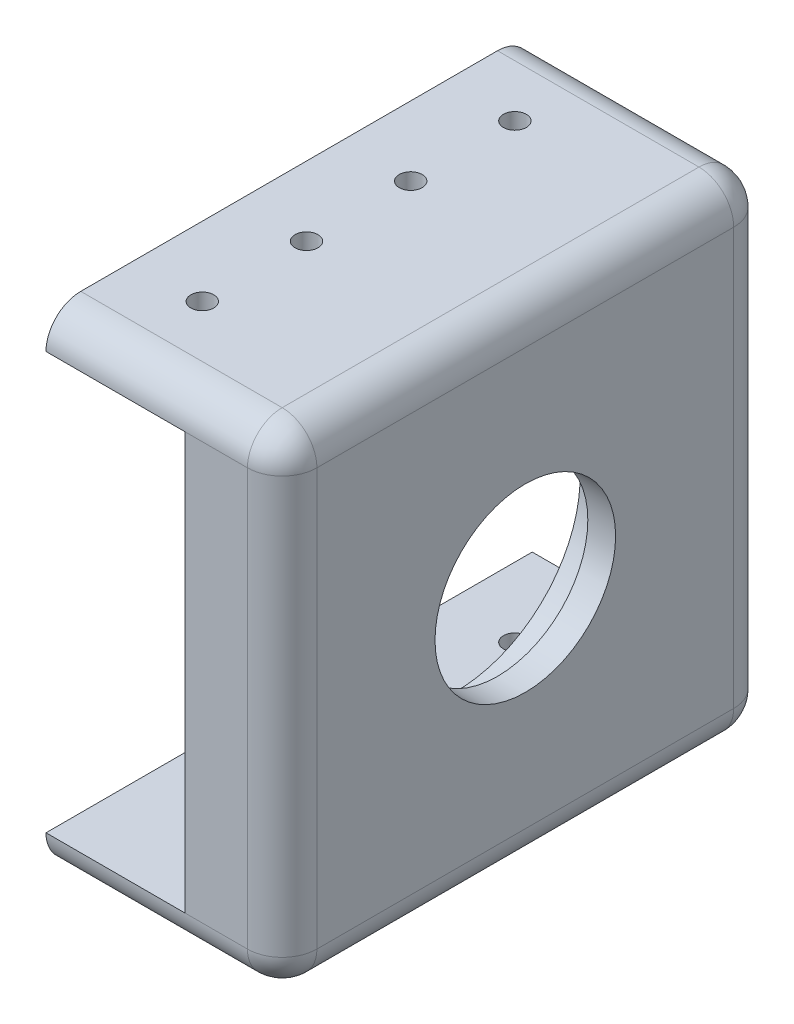
from build123d import *

# Parameters (mm, degrees)
BOSS_EXTRUDE1_DEPTH       = 70
FILLET1_R                 = 5
FILLET2_R                 = 5
M4X0_7_TAPPED_HOLE1_D     = 3.3
M4X0_7_TAPPED_HOLE1_DEPTH = 5
SKETCH13_R                = 25
CUT_EXTRUDE1_DEPTH        = 4
SKETCH14_R                = 17.9
CUT_EXTRUDE2_DEPTH        = 2
SKETCH15_R                = 17.5
CUT_EXTRUDE3_DEPTH        = 4
SKETCH16_R                = 13
CUT_EXTRUDE4_DEPTH        = 84.815273071
SKETCH17_R                = 17.9
CUT_EXTRUDE5_DEPTH        = 3


with BuildPart() as part:
    # Sketch1 → Boss-Extrude1 (new body)
    with BuildSketch(Plane.XY):
        Polygon((0, -30), (0, -35), (34, -35), (34, 35), (0, 35), (0, 30), (20, 30), (20, -30), align=None)
    extrude(amount=BOSS_EXTRUDE1_DEPTH)

    # Fillet1
    fillet1_edges = [part.edges().sort_by_distance(p)[0] for p in [
        (17, -35, 70),
        (17, -35, 0),
        (17, 35, 0),
        (17, 35, 70),
    ]]
    fillet(fillet1_edges, radius=FILLET1_R - 0.0001)  # a hair under: the kernel refuses the full size

    # Fillet2
    fillet2_edges = [part.edges().sort_by_distance(p)[0] for p in [
        (34, 0, 70),
        (34, 0, 0),
        (34, 35, 35),
        (34, -35, 35),
        (34, 33.535563195, 68.535563195),
        (34, 33.535563195, 1.464436805),
        (34, -33.535563195, 1.464436805),
        (34, -33.535563195, 68.535563195),
    ]]
    fillet(fillet2_edges, radius=FILLET2_R - 0.0001)  # a hair under: the kernel refuses the full size

    # M4x0.7 Tapped Hole1
    with Locations(Plane(origin=(0, 35, 0), x_dir=(1, 0, 0), z_dir=(0, 1, 0))):
        with Locations((10, -12.5), (10, -27.5), (10, -42.5), (10, -57.5)):
            m4x0_7_tapped_hole1 = Hole(M4X0_7_TAPPED_HOLE1_D / 2, depth=M4X0_7_TAPPED_HOLE1_DEPTH)

    # Mirror1: M4x0.7 Tapped Hole1 across plane
    add(m4x0_7_tapped_hole1.mirror(Plane.ZX), mode=Mode.SUBTRACT)

    # Sketch13 → Cut-Extrude1 (cut)
    with BuildSketch(Plane.ZY.offset(-20)):
        with Locations((35, 0)):
            Circle(SKETCH13_R)
    extrude(amount=-CUT_EXTRUDE1_DEPTH, mode=Mode.SUBTRACT)

    # Sketch14 → Cut-Extrude2 (cut)
    with BuildSketch(Plane.ZY.offset(-24)):
        with Locations((35, 0)):
            Circle(SKETCH14_R)
    extrude(amount=-CUT_EXTRUDE2_DEPTH, mode=Mode.SUBTRACT)

    # Sketch15 → Cut-Extrude3 (cut)
    with BuildSketch(Plane.ZY.offset(-26)):
        with Locations((35, 0)):
            Circle(SKETCH15_R)
    extrude(amount=-CUT_EXTRUDE3_DEPTH, mode=Mode.SUBTRACT)

    # Sketch16 → Cut-Extrude4 (cut, through all)
    with BuildSketch(Plane.ZY.offset(-30)):
        with Locations((35, 0)):
            Circle(SKETCH16_R)
    extrude(amount=-CUT_EXTRUDE4_DEPTH, mode=Mode.SUBTRACT)

    # Sketch17 → Cut-Extrude5 (cut)
    with BuildSketch(Plane.ZY.offset(-26)):
        with Locations((35, 0)):
            Circle(SKETCH17_R)
    extrude(amount=-CUT_EXTRUDE5_DEPTH, mode=Mode.SUBTRACT)


solid = part.part
